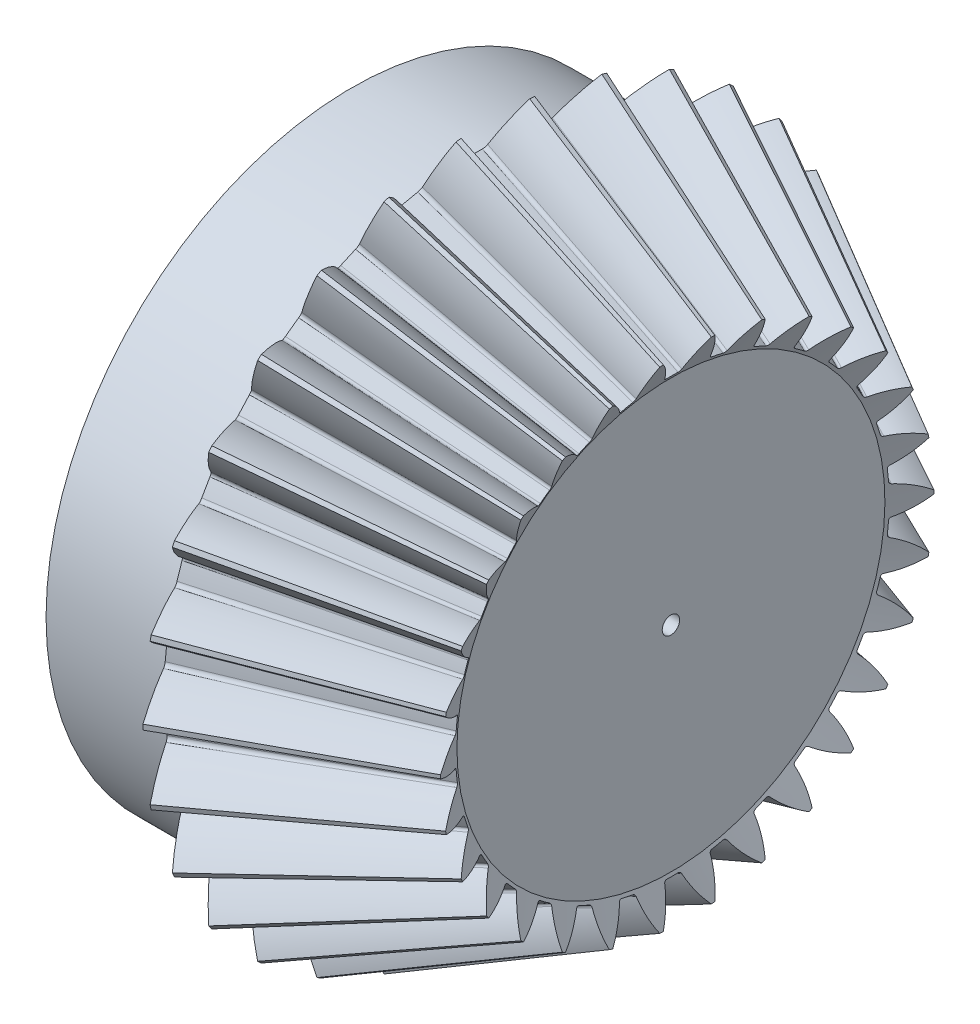
from build123d import *

# Parameters (mm, degrees)
TEETHCUTS_COUNT = 30
TEETHCUTS_ANGLE = 348
HUBSKE_R        = 17.57075365
HUB_DEPTH       = 6.910478425
BORSKE_R        = 0.5
BORE_DEPTH      = 45.0000508


with BuildPart() as part:
    # BasProSke → Base-Revolve (revolve)
    with BuildSketch(Plane(origin=(0, 0, 0), x_dir=(1, 0, 0), z_dir=(0, 1, 0)), mode=Mode.PRIVATE) as base_revolve_sk:
        Polygon((0, 0), (0, 17.570753651), (1.341501034, 20.253755714), (12.36779376, 14.17660601), (11.428810794, 12.29864008), (11.428810794, 0), align=None)
    revolve(base_revolve_sk.sketch.rotate(Axis((-10, 0, 0), (1, 0, 0)), 180), axis=Axis((-10, 0, 0), (1, 0, 0)))

    # ToothCut: read off the stored shape, not the designer's step
    # ToothCut: loft between two sections, ruled curve by curve
    toothcut_from = [
        Edge.make_bspline([(38.093308382, 0.007370413, -0.009663638), (38.090671126, 0.002095901, -0.01469221), (38.087224439, -0.004797473, -0.013877417), (38.085115728, -0.009014895, -0.007726903)], [0, 0, 0, 0, 1, 1, 1, 1], 3, [1, 0.792321717, 0.792321717, 1]),
        Edge.make_bspline([(38.085115728, -0.009014895, 0.007726903), (38.087224439, -0.004797473, 0.013877417), (38.090671126, 0.002095901, 0.01469221), (38.093308382, 0.007370413, 0.009663638)], [0, 0, 0, 0, 1, 1, 1, 1], 3, [1, 0.792321717, 0.792321717, 1]),
        Edge.make_bspline([(38.085115728, -0.009014895, -0.007726903), (38.08483135, -0.00958365, -0.006897454), (38.084594685, -0.010056982, -0.005996185), (38.084409314, -0.010427722, -0.005036743)], [0, 0, 0, 0, 1, 1, 1, 1], 3, [1, 0.994952652, 0.994952652, 1]),
        Edge.make_bspline([(38.084409314, -0.010427722, 0.005036743), (38.084594685, -0.010056982, 0.005996185), (38.08483135, -0.00958365, 0.006897454), (38.085115728, -0.009014895, 0.007726903)], [0, 0, 0, 0, 1, 1, 1, 1], 3, [1, 0.994952652, 0.994952652, 1]),
        Edge.make_bspline([(38.084409314, -0.010427722, -0.005036743), (38.08377932, -0.01168771, -0.00177601), (38.08377932, -0.01168771, 0.00177601), (38.084409314, -0.010427722, 0.005036743)], [0, 0, 0, 0, 1, 1, 1, 1], 3, [1, 0.945329424, 0.945329424, 1]),
        Edge.make_line((38.093308382, 0.007370413, 0.009663638), (38.093308382, 0.007370413, -0.009663638)),
    ]
    toothcut_to = [
        Edge.make_bspline([(1.468423137, 20.50759992, -2.277460493), (1.09800558, 19.766764808, -1.545785094), (0.665285022, 18.901323693, -1.011781991), (0.190980929, 17.952715509, -0.701020251)], [0, 0, 0, 0, 1, 1, 1, 1], 3, [1, 0.984039378, 0.984039378, 1]),
        Edge.make_bspline([(0.190980929, 17.952715509, 0.701020251), (0.665285022, 18.901323693, 1.011781991), (1.09800558, 19.766764808, 1.545785094), (1.468423137, 20.50759992, 2.277460493)], [0, 0, 0, 0, 1, 1, 1, 1], 3, [1, 0.984039378, 0.984039378, 1]),
        Edge.make_bspline([(0.190980929, 17.952715509, -0.701020251), (0.143171317, 17.857096285, -0.669695625), (0.113834477, 17.798422603, -0.579657988), (0.115152933, 17.801059516, -0.468296704)], [0, 0, 0, 0, 1, 1, 1, 1], 3, [1, 0.861578759, 0.861578759, 1]),
        Edge.make_bspline([(0.115152933, 17.801059516, 0.468296704), (0.113834477, 17.798422603, 0.579657988), (0.143171317, 17.857096285, 0.669695625), (0.190980929, 17.952715509, 0.701020251)], [0, 0, 0, 0, 1, 1, 1, 1], 3, [1, 0.861578759, 0.861578759, 1]),
        Edge.make_bspline([(0.115152933, 17.801059516, -0.468296704), (0.118848752, 17.808451154, -0.156135359), (0.118848752, 17.808451154, 0.156135359), (0.115152933, 17.801059516, 0.468296704)], [0, 0, 0, 0, 1, 1, 1, 1], 3, [1, 0.999766502, 0.999766502, 1]),
        Edge.make_line((1.468423137, 20.50759992, 2.277460493), (1.468423137, 20.50759992, -2.277460493)),
    ]
    toothcut = Solid(Shell([*[Face.make_surface_from_curves(toothcut_from[k], toothcut_to[k]) for k in range(6)], Face(Wire(toothcut_from)), Face(Wire(toothcut_to))]))
    add(toothcut, mode=Mode.SUBTRACT)

    # TeethCuts: ToothCut ×30 about axis
    teethcuts_axis = Axis((-10, 0, 0), (1, 0, 0))
    for i in range(1, TEETHCUTS_COUNT):
        add(toothcut.rotate(teethcuts_axis, i * TEETHCUTS_ANGLE / (TEETHCUTS_COUNT - 1)), mode=Mode.SUBTRACT)

    # HubSke → Hub (add)
    with BuildSketch(Plane.ZY):
        Circle(HUBSKE_R)
    extrude(amount=HUB_DEPTH)

    # BorSke → Bore (cut, symmetric)
    with BuildSketch(Plane(origin=(0, 0, 0), x_dir=(0, 0, -1), z_dir=(1, 0, 0))):
        with Locations(Location((0, 0, 0), (0, 0, 180))):
            Circle(BORSKE_R)
    extrude(amount=BORE_DEPTH, both=True, mode=Mode.SUBTRACT)


solid = part.part
